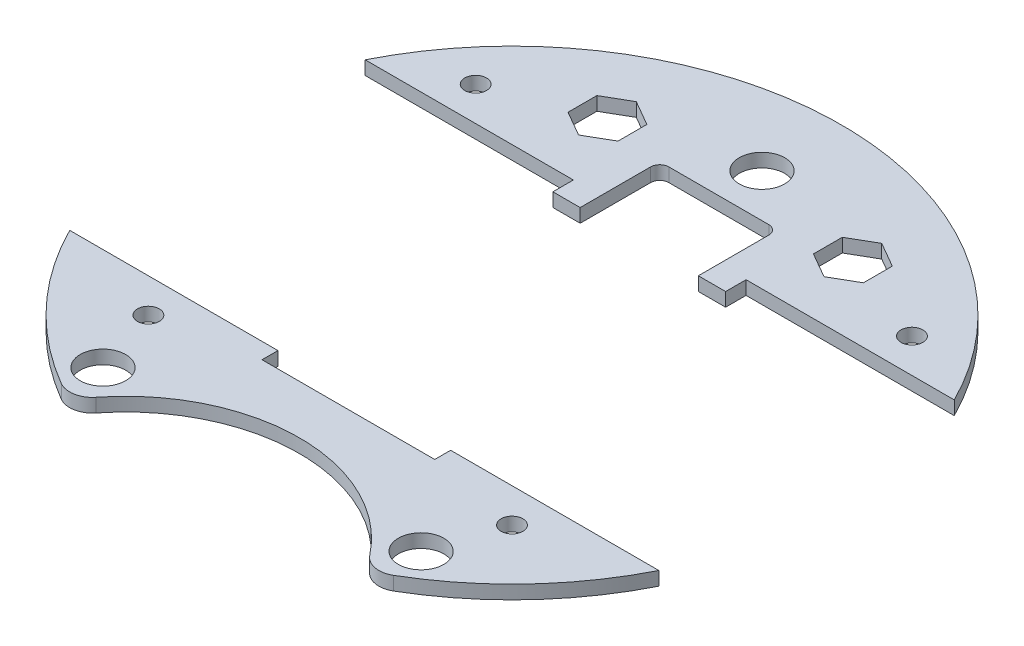
from build123d import *

# Parameters (mm, degrees)
BOSS_EXTRUDE1_DEPTH  = 3
SOLENOID_PLACEMENT_W = 38
SOLENOID_PLACEMENT_H = 64
CUT_EXTRUDE1_DEPTH   = 103.574363269
CUT_EXTRUDE4_DEPTH   = 103.574363269
CUT_EXTRUDE5_DEPTH   = 103.574363269
SKETCH6_R            = 2.4
CUT_EXTRUDE6_DEPTH   = 103.574363269
CUT_EXTRUDE3_DEPTH   = 103.574363269
SKETCH7_R            = 5
CUT_EXTRUDE7_DEPTH   = 98.289516393
SKETCH8_R            = 5
CUT_EXTRUDE9_DEPTH   = 98.289516393


with BuildPart() as part:
    # Sketch1 → Boss-Extrude1 (new body)
    with BuildSketch(Plane(origin=(0, 0, 0), x_dir=(1, 0, 0), z_dir=(0, 1, 0))):
        with BuildLine():
            ThreePointArc((36.543377003, -62.616544118), (0, 72.5), (-36.543377003, -62.616544118))
            ThreePointArc((-36.543377003, -62.616544118), (-33.085954668, -63.20954405), (-30.089832649, -61.38507948))
            ThreePointArc((-30.089832649, -61.38507948), (0, -46.75), (30.089832649, -61.38507948))
            ThreePointArc((30.089832649, -61.38507948), (33.085954668, -63.20954405), (36.543377003, -62.616544118))
        make_face()
    extrude(amount=BOSS_EXTRUDE1_DEPTH)

    # solenoid placement → Cut-Extrude1 (cut, through all)
    with BuildSketch(Plane(origin=(0, 3, 0), x_dir=(1, 0, 0), z_dir=(0, 1, 0))):
        with Locations((0, -4)):
            Rectangle(SOLENOID_PLACEMENT_W, SOLENOID_PLACEMENT_H)
    extrude(amount=-CUT_EXTRUDE1_DEPTH, mode=Mode.SUBTRACT)

    # Sketch4 → Cut-Extrude4 (cut, through all)
    with BuildSketch(Plane(origin=(0, 3, 0), x_dir=(1, 0, 0), z_dir=(0, 1, 0))):
        with BuildLine():
            Line((13, 28), (13, 43.5))
            ThreePointArc((13, 43.5), (12.414213562, 44.914213562), (11, 45.5))
            Line((11, 45.5), (-11, 45.5))
            ThreePointArc((-11, 45.5), (-12.414213562, 44.914213562), (-13, 43.5))
            Line((-13, 43.5), (-13, 28))
            Line((-13, 28), (13, 28))
        make_face()
    extrude(amount=-CUT_EXTRUDE4_DEPTH, mode=Mode.SUBTRACT)

    # Sketch5 → Cut-Extrude5 (cut, through all)
    with BuildSketch(Plane(origin=(0, 3, 0), x_dir=(1, 0, 0), z_dir=(0, 1, 0))):
        Polygon((-21.5, 51.175426481), (-27, 54.350852961), (-32.5, 51.175426481), (-32.5, 44.824573519), (-27, 41.649147039), (-21.5, 44.824573519), align=None)
        Polygon((21.5, 51.175426481), (21.5, 44.824573519), (27, 41.649147039), (32.5, 44.824573519), (32.5, 51.175426481), (27, 54.350852961), align=None)
    extrude(amount=-CUT_EXTRUDE5_DEPTH, mode=Mode.SUBTRACT)

    # Sketch6 → Cut-Extrude6 (cut, through all)
    with BuildSketch(Plane(origin=(0, 3, 0), x_dir=(1, 0, 0), z_dir=(0, 1, 0))):
        with Locations((40, -40)):
            Circle(SKETCH6_R)
        with Locations((-40, -40)):
            Circle(SKETCH6_R)
        with Locations((48, 40)):
            Circle(SKETCH6_R)
        with Locations((-48, 40)):
            Circle(SKETCH6_R)
    extrude(amount=-CUT_EXTRUDE6_DEPTH, mode=Mode.SUBTRACT)

    # Sketch3 → Cut-Extrude3 (cut, through all)
    with BuildSketch(Plane(origin=(0, 3, 0), x_dir=(1, 0, 0), z_dir=(0, 1, 0))):
        Polygon((-19, 28), (-19, 32.5), (-72.5, 32.5), (-72.5, -32.5), (72.5, -32.5), (72.5, 32.5), (19, 32.5), (19, 28), align=None)
    extrude(amount=-CUT_EXTRUDE3_DEPTH, mode=Mode.SUBTRACT)


with BuildPart() as cut_extrude3_piece_1:
    # of the separate pieces the step leaves, piece 1, a body of its own (cut_extrude3_pieces)
    add(part.part.solids().sort_by_distance((64.807406984, 0, -32.5))[0])

    # Sketch8 → Cut-Extrude9 (cut, through all)
    with BuildSketch(Plane.XZ.offset(-3)):
        with Locations((0, -55)):
            Circle(SKETCH8_R)
    extrude(amount=CUT_EXTRUDE9_DEPTH, mode=Mode.SUBTRACT)


with BuildPart() as cut_extrude3_piece_2:
    # of the separate pieces the step leaves, piece 2, a body of its own (cut_extrude3_pieces)
    add(part.part.solids().sort_by_distance((-36.543377003, 0, 62.616544118))[0])

    # Sketch7 → Cut-Extrude7 (cut, through all)
    with BuildSketch(Plane(origin=(0, 3, 0), x_dir=(1, 0, 0), z_dir=(0, 1, 0))):
        with Locations((35, -55)):
            Circle(SKETCH7_R)
        with Locations((-35, -55)):
            Circle(SKETCH7_R)
    extrude(amount=-CUT_EXTRUDE7_DEPTH, mode=Mode.SUBTRACT)


solid = Compound([cut_extrude3_piece_1.part, cut_extrude3_piece_2.part])
